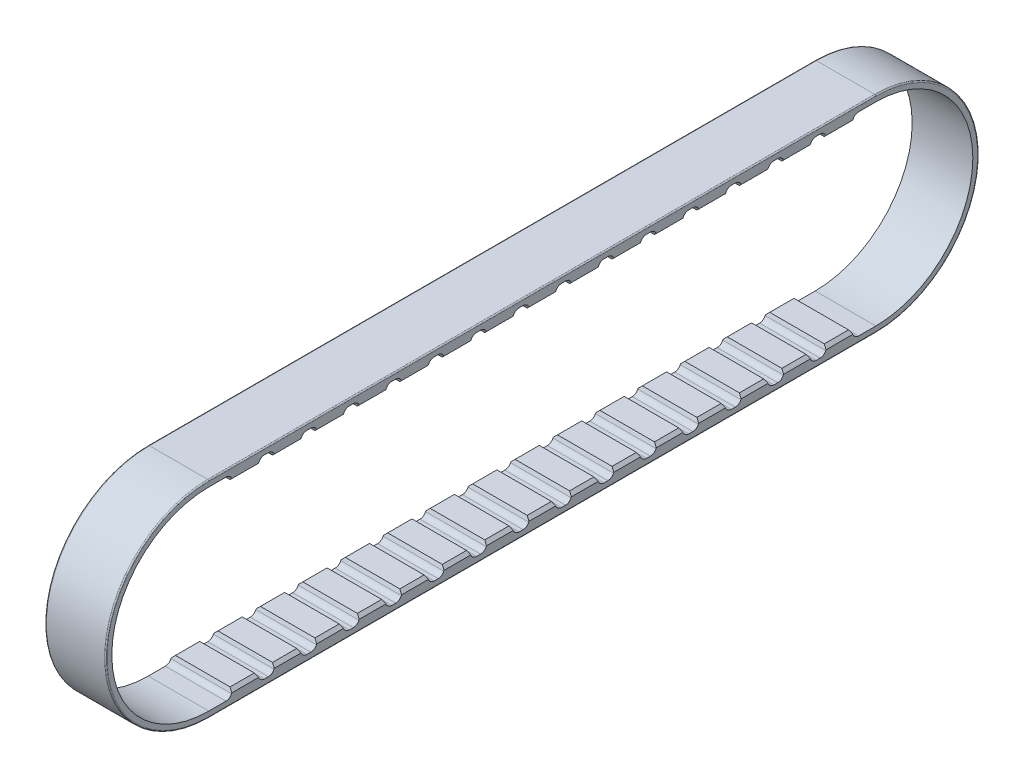
from build123d import *

# Parameters (mm, degrees)
BOSS_EXTRUDE1_DEPTH            = 5
FILLET1_R                      = 0.2
BOSS_EXTRUDE2_DEPTH            = 5
CHAMFER1_SIZE                  = 0.5
LPATTERN1_COUNT                = 8
LPATTERN1_PITCH                = 7
CHAMFER1_OF_LPATTERN1_SIZE     = 0.5
LPATTERN1_COL_COUNT            = 8
LPATTERN1_COL_PITCH            = 7
CHAMFER1_OF_LPATTERN1_COL_SIZE = 0.5


# Read off the part's stored shape, not the designer's step: Mirror1
with BuildPart() as part:
    # Sketch1 → Boss-Extrude1 (new, symmetric)
    with BuildSketch(Plane(origin=(0, 0, 0), x_dir=(0, 0, -1), z_dir=(1, 0, 0))):
        with BuildLine():
            Line((-55, 17), (55, 17))
            ThreePointArc((55, 17), (72, 0), (55, -17))
            Line((55, -17), (-55, -17))
            ThreePointArc((-55, -17), (-72, 0), (-55, 17))
        make_face()
        with BuildLine():
            Line((-55, 16), (55, 16))
            ThreePointArc((55, 16), (71, 0), (55, -16))
            Line((55, -16), (-55, -16))
            ThreePointArc((-55, -16), (-71, 0), (-55, 16))
        make_face(mode=Mode.SUBTRACT)
    extrude(amount=BOSS_EXTRUDE1_DEPTH, both=True)

    # Fillet1
    fillet1_edges = [part.edges().sort_by_distance(p)[0] for p in [
        (5, 0, -72),
        (5, 17, 0),
        (5, 0, 72),
        (-5, 17, 0),
        (-5, 0, -72),
        (-5, -17, 0),
        (-5, 0, 72),
        (5, -17, 0),
    ]]
    fillet(fillet1_edges, radius=FILLET1_R)

    # Sketch2 → Boss-Extrude2 (add, symmetric)
    with BuildSketch(Plane(origin=(0, 0, 0), x_dir=(0, 0, -1), z_dir=(1, 0, 0))):
        with BuildLine():
            Line((3.170774402, 16), (-3.170774402, 16))
            ThreePointArc((-3.170774402, 16), (-2.618549585, 15.833695239), (-2.25, 15.390095501))
            Line((-2.25, 15.390095501), (-2, 14.8))
            Line((-2, 14.8), (2, 14.8))
            Line((2, 14.8), (2.25, 15.390095501))
            ThreePointArc((2.25, 15.390095501), (2.618549585, 15.833695239), (3.170774402, 16))
        make_face()
    boss_extrude2 = extrude(amount=BOSS_EXTRUDE2_DEPTH, both=True)

    # Chamfer1
    chamfer1_edges = [part.edges().sort_by_distance(p)[0] for p in [
        (-5, 14.8, 0),
        (5, 14.8, 0),
    ]]
    chamfer(chamfer1_edges, length=CHAMFER1_SIZE)

    # LPattern1: Boss-Extrude2 ×8
    with Locations(*[(0, 0, i * LPATTERN1_PITCH) for i in range(1, LPATTERN1_COUNT)]):
        add(boss_extrude2)

    # Chamfer1 of LPattern1
    chamfer1_of_lpattern1_edges = [part.edges().sort_by_distance(p)[0] for p in [
        (-5, 14.8, 7),
        (5, 14.8, 7),
        (-5, 14.8, 14),
        (5, 14.8, 14),
        (-5, 14.8, 21),
        (5, 14.8, 21),
        (-5, 14.8, 28),
        (5, 14.8, 28),
        (-5, 14.8, 35),
        (5, 14.8, 35),
        (-5, 14.8, 42),
        (5, 14.8, 42),
        (-5, 14.8, 49),
        (5, 14.8, 49),
    ]]
    chamfer(chamfer1_of_lpattern1_edges, length=CHAMFER1_OF_LPATTERN1_SIZE)

    # LPattern1 col: Boss-Extrude2 ×8
    with Locations(*[(0, 0, -i * LPATTERN1_COL_PITCH) for i in range(1, LPATTERN1_COL_COUNT)]):
        add(boss_extrude2)

    # Chamfer1 of LPattern1 col
    chamfer1_of_lpattern1_col_edges = [part.edges().sort_by_distance(p)[0] for p in [
        (-5, 14.8, -7),
        (5, 14.8, -7),
        (-5, 14.8, -14),
        (5, 14.8, -14),
        (-5, 14.8, -21),
        (5, 14.8, -21),
        (-5, 14.8, -28),
        (5, 14.8, -28),
        (-5, 14.8, -35),
        (5, 14.8, -35),
        (-5, 14.8, -42),
        (5, 14.8, -42),
        (-5, 14.8, -49),
        (5, 14.8, -49),
    ]]
    chamfer(chamfer1_of_lpattern1_col_edges, length=CHAMFER1_OF_LPATTERN1_COL_SIZE)

    # Mirror1: part across plane


with BuildPart() as part_1:
    add(part.part)
    add(part.part.mirror(Plane.ZX))


solid = part_1.part
